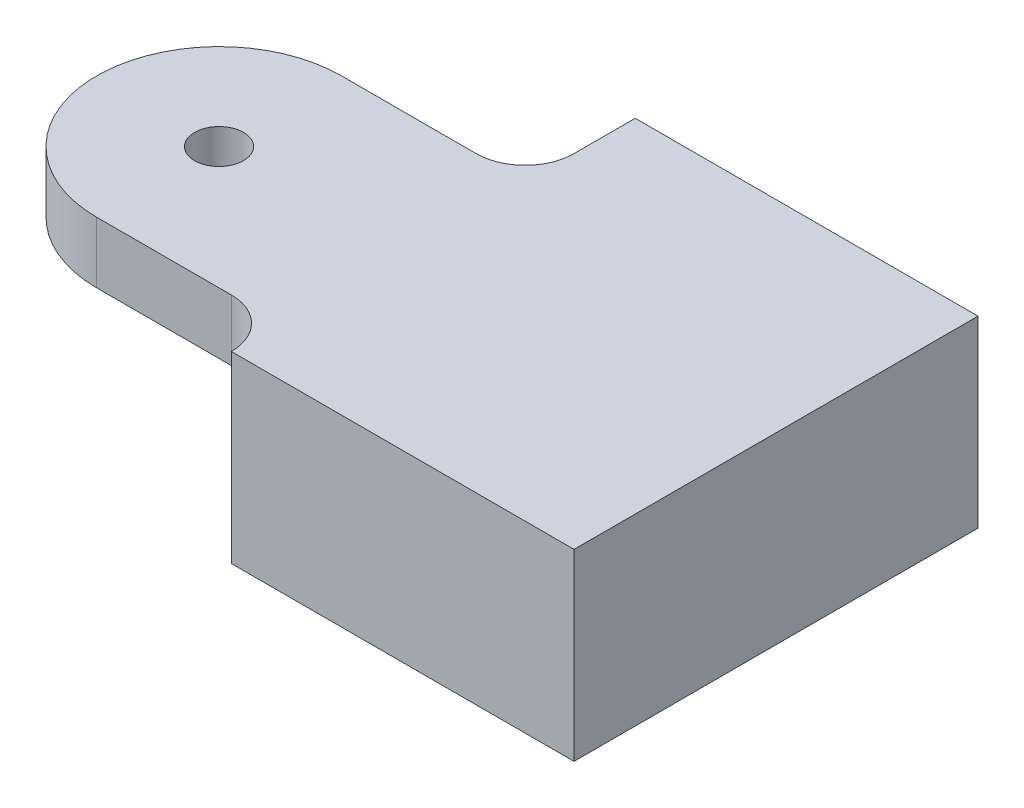
from build123d import *

# Parameters (mm, degrees)
AUFSATZ_LINEAR_AUSTRAGEN1_DEPTH = 5
SKIZZE4_W                       = 28
SKIZZE4_H                       = 33
AUFSATZ_LINEAR_AUSTRAGEN3_DEPTH = 10
VERRUNDUNG1_R                   = 4
VERRUNDUNG2_R                   = 4


with BuildPart() as part:
    # Skizze2 → Aufsatz-Linear austragen1 (new body)
    with BuildSketch(Plane(origin=(0, 0, 0), x_dir=(1, 0, 0), z_dir=(0, 1, 0))):
        with BuildLine():
            Line((0, 33), (-28, 33))
            Line((-28, 33), (-28, 24))
            Line((-28, 24), (-43, 24))
            ThreePointArc((-43, 24), (-35.928932188, 21.071067812), (-33, 14))
            ThreePointArc((-33, 14), (-35.928932188, 6.928932188), (-43, 4))
            Line((-43, 4), (-28, 4))
            Line((-28, 4), (-28, 0))
            Line((-28, 0), (0, 0))
            Line((0, 0), (0, 33))
        make_face()
        with BuildLine():
            ThreePointArc((-33, 14), (-35.928932188, 21.071067812), (-43, 24))
            Line((-43, 24), (-43, 16))
            ThreePointArc((-43, 16), (-41.585786438, 15.414213562), (-41, 14))
            ThreePointArc((-41, 14), (-41.585786438, 12.585786438), (-43, 12))
            Line((-43, 12), (-43, 4))
            ThreePointArc((-43, 4), (-35.928932188, 6.928932188), (-33, 14))
        make_face()
        with BuildLine():
            Line((-43, 16), (-43, 24))
            ThreePointArc((-43, 24), (-53, 14), (-43, 4))
            Line((-43, 4), (-43, 12))
            ThreePointArc((-43, 12), (-45, 14), (-43, 16))
        make_face()
    extrude(amount=AUFSATZ_LINEAR_AUSTRAGEN1_DEPTH)

    # Skizze4 → Aufsatz-Linear austragen3 (add)
    with BuildSketch(Plane.XZ):
        with Locations((-14, -16.5)):
            Rectangle(SKIZZE4_W, SKIZZE4_H)
    extrude(amount=AUFSATZ_LINEAR_AUSTRAGEN3_DEPTH)

    # Verrundung1
    verrundung1_edges = [part.edges().sort_by_distance(p)[0] for p in [
        (-28, 2.5, -4),
    ]]
    fillet(verrundung1_edges, radius=VERRUNDUNG1_R - 0.0001)  # a hair under: the kernel refuses the full size

    # Verrundung2
    verrundung2_edges = [part.edges().sort_by_distance(p)[0] for p in [
        (-28, 2.5, -24),
    ]]
    fillet(verrundung2_edges, radius=VERRUNDUNG2_R)


solid = part.part
